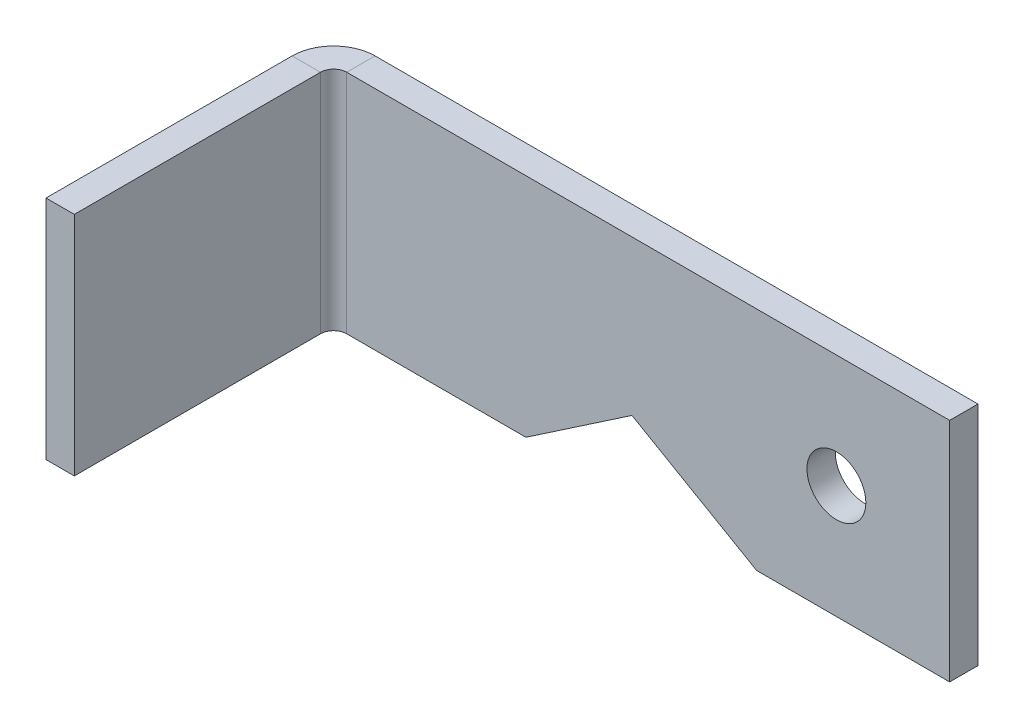
from build123d import *

# Parameters (mm, degrees)
ESBO_O1_W               = 50
ESBO_O1_H               = 12.7
FLANGE_BASE1_DEPTH      = 1.5875
DOBRA_START             = -6.35
DOBRA_ESBO_ADA1_DEPTH   = 12.7
DOBRA_ESBO_ADA1_2_DEPTH = 12.7
CORTE_EXTRUS_O1_DEPTH   = 10
ESBO_O8_R               = 1.65
CORTE_EXTRUS_O2_DEPTH   = 10


# Read off the part's stored shape, not the designer's step: Dobra esboçada1
# Sheet-metal steps are written as plain solids
with BuildPart() as part:
    # Esboço1 → Flange-base1 (new body)
    with BuildSketch(Plane.XY):
        Rectangle(ESBO_O1_W, ESBO_O1_H)
    extrude(amount=-FLANGE_BASE1_DEPTH)

    # Dobra esboçada1 outline → Dobra esboçada1 (cut)
    with BuildSketch(Plane(origin=(0, 0, 0), x_dir=(1, 0, 0), z_dir=(0, 1, 0)).offset(DOBRA_START)):
        with BuildLine():
            Line((-25, 0), (-11.0023484, 0))
            ThreePointArc((-11.0023484, 0), (-10.156283273, 1.149317929), (-8.798065921, 1.5875))
            Line((-8.798065921, 1.5875), (-25, 1.5875))
            Line((-25, 1.5875), (-25, 0))
        make_face()
    extrude(amount=DOBRA_ESBO_ADA1_DEPTH, mode=Mode.SUBTRACT)

    # Dobra esbo_ada1 2 outline → Dobra esbo_ada1 2 (add)
    with BuildSketch(Plane(origin=(0, 0, 0), x_dir=(1, 0, 0), z_dir=(0, 1, 0)).offset(DOBRA_START)):
        with BuildLine():
            Line((-11.122165921, -14.534665921), (-9.534665921, -14.534665921))
            Line((-9.534665921, -14.534665921), (-9.534665921, -0.7366))
            ThreePointArc((-9.534665921, -0.7366), (-9.318920776, -0.215745145), (-8.798065921, 0))
            Line((-8.798065921, 0), (-11.0023484, 0))
            ThreePointArc((-11.0023484, 0), (-11.092015977, -0.363459343), (-11.122165921, -0.7366))
            Line((-11.122165921, -0.7366), (-11.122165921, -14.534665921))
        make_face()
    extrude(amount=DOBRA_ESBO_ADA1_2_DEPTH)

    # Esboço7 → Corte-extrusão1 (cut)
    with BuildSketch(Plane.XY):
        Polygon((1.246385816, -6.35), (7.190135396, -2.315813979), (14.178296509, -6.35), align=None)
    extrude(amount=-CORTE_EXTRUS_O1_DEPTH, mode=Mode.SUBTRACT)

    # Esboço8 → Corte-extrusão2 (cut)
    with BuildSketch(Plane.XY):
        with Locations((18.65, 0)):
            Circle(ESBO_O8_R)
    extrude(amount=-CORTE_EXTRUS_O2_DEPTH, mode=Mode.SUBTRACT)


solid = part.part
